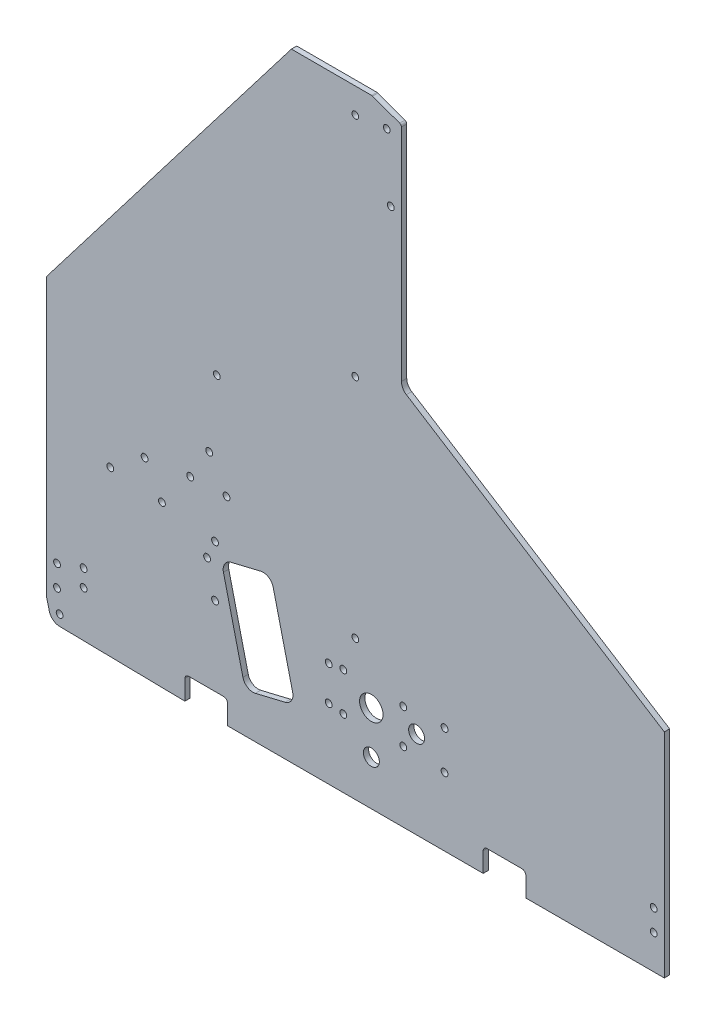
from build123d import *

# Parameters (mm, degrees)
SKETCH1_R           = 2.032
SKETCH1_R_2         = 2
BOSS_EXTRUDE1_DEPTH = 3.175
FILLET1_R           = 2.286
FILLET2_R           = 6.35
SKETCH2_R           = 2.032
CUT_EXTRUDE1_DEPTH  = 507.700158896
FILLET3_R           = 1.5875
CUT_EXTRUDE2_DEPTH  = 507.700158896
SKETCH4_R           = 2.032
SKETCH4_R_2         = 6.985
SKETCH4_R_3         = 4.7625
CUT_EXTRUDE3_DEPTH  = 507.700158896


with BuildPart() as part:
    # Sketch1 → Boss-Extrude1 (new body)
    with BuildSketch(Plane.XY):
        with BuildLine():
            Line((7.829508682, -19.049081656), (82.55, -20.32))
            Line((82.55, -20.32), (82.55, -6.35))
            Line((82.55, -6.35), (107.95, -6.35))
            Line((107.95, -6.35), (107.95, -20.32))
            Line((107.95, -20.32), (260.35, -20.32))
            Line((260.35, -20.32), (260.35, -6.35))
            Line((260.35, -6.35), (285.75, -6.35))
            Line((285.75, -6.35), (285.75, -20.32))
            Line((285.75, -20.32), (368.3, -20.32))
            Line((368.3, -20.32), (368.3, 106.68))
            Line((368.3, 106.68), (211.61375, 205.74))
            Line((211.61375, 205.74), (211.61375, 341.63))
            Line((211.61375, 341.63), (194.14998, 347.98))
            Line((194.14998, 347.98), (184.15, 347.98))
            Line((184.15, 347.98), (146.05, 347.98))
            Line((146.05, 347.98), (0, 157.48))
            Line((0, 157.48), (0, 0))
            Line((0, 0), (0, -6.35))
            ThreePointArc((0, -6.35), (0.047577015, -7.125863724), (0.189595124, -7.890101219))
            Line((0.189595124, -7.890101219), (1.777095124, -14.240101219))
            ThreePointArc((1.777095124, -14.240101219), (3.987212552, -17.671692778), (7.829508682, -19.049081656))
        make_face()
        with Locations((7.9375, -12.7)):
            Circle(SKETCH1_R, mode=Mode.SUBTRACT)
        with Locations((6.35, 0)):
            Circle(SKETCH1_R, mode=Mode.SUBTRACT)
        with Locations((6.35, 12.7)):
            Circle(SKETCH1_R, mode=Mode.SUBTRACT)
        with Locations((95.797306087, 60.410494967)):
            Circle(SKETCH1_R, mode=Mode.SUBTRACT)
        with Locations((184.15, 62.98)):
            Circle(SKETCH1_R_2, mode=Mode.SUBTRACT)
        with Locations((38.1, 78.105)):
            Circle(SKETCH1_R, mode=Mode.SUBTRACT)
        with Locations((68.887329744, 75.518700365)):
            Circle(SKETCH1_R, mode=Mode.SUBTRACT)
        with Locations((58.568579744, 93.391299635)):
            Circle(SKETCH1_R, mode=Mode.SUBTRACT)
        with Locations((85.725, 97.155)):
            Circle(SKETCH1_R, mode=Mode.SUBTRACT)
        with Locations((107.382158942, 97.743700365)):
            Circle(SKETCH1_R, mode=Mode.SUBTRACT)
        with Locations((97.063408942, 115.616299635)):
            Circle(SKETCH1_R, mode=Mode.SUBTRACT)
        with Locations((101.6, 157.48)):
            Circle(SKETCH1_R, mode=Mode.SUBTRACT)
        with Locations((361.95, 0)):
            Circle(SKETCH1_R, mode=Mode.SUBTRACT)
        with Locations((361.95, 12.7)):
            Circle(SKETCH1_R, mode=Mode.SUBTRACT)
        with Locations((184.15, 197.98)):
            Circle(SKETCH1_R_2, mode=Mode.SUBTRACT)
        with Locations((184.15, 332.98)):
            Circle(SKETCH1_R_2, mode=Mode.SUBTRACT)
        with Locations((205.26375, 296.418)):
            Circle(SKETCH1_R, mode=Mode.SUBTRACT)
        with Locations((202.881865, 335.28)):
            Circle(SKETCH1_R_2, mode=Mode.SUBTRACT)
    extrude(amount=BOSS_EXTRUDE1_DEPTH)

    # Fillet1
    fillet1_edges = [part.edges().sort_by_distance(p)[0] for p in [
        (285.75, -6.35, 1.5875),
        (107.95, -6.35, 1.5875),
        (260.35, -6.35, 1.5875),
        (82.55, -6.35, 1.5875),
    ]]
    fillet(fillet1_edges, radius=FILLET1_R)

    # Fillet2
    fillet2_edges = [part.edges().sort_by_distance(p)[0] for p in [
        (211.61375, 205.74, 1.5875),
    ]]
    fillet(fillet2_edges, radius=FILLET2_R)

    # Sketch2 → Cut-Extrude1 (cut, through all)
    with BuildSketch(Plane(origin=(0, 0, 0), x_dir=(-1, 0, 0), z_dir=(0, 0, -1))):
        with Locations((-100.552770272, 71.086035298)):
            Circle(SKETCH2_R)
        with Locations((-100.552770272, 40.606035298)):
            Circle(SKETCH2_R)
        with Locations((-22.225, 18.202541089)):
            Circle(SKETCH2_R)
        with Locations((-22.225, 8.042541089)):
            Circle(SKETCH2_R)
    extrude(amount=-CUT_EXTRUDE1_DEPTH, mode=Mode.SUBTRACT)

    # Fillet3
    fillet3_edges = [part.edges().sort_by_distance(p)[0] for p in [
        (211.61375, 341.63, 1.5875),
        (194.14998, 347.98, 1.5875),
    ]]
    fillet(fillet3_edges, radius=FILLET3_R)

    # Sketch3 → Cut-Extrude2 (cut, through all)
    with BuildSketch(Plane.XY.offset(3.175)):
        with BuildLine():
            Line((127.789350211, 69.359774106), (110.090750339, 65.117184968))
            ThreePointArc((110.090750339, 65.117184968), (106.287939856, 62.356288953), (105.55119507, 57.715047577))
            Line((105.55119507, 57.715047577), (117.160037875, 9.287010566))
            ThreePointArc((117.160037875, 9.287010566), (119.92093389, 5.484200083), (124.562175266, 4.747455297))
            Line((124.562175266, 4.747455297), (142.260775137, 8.990044434))
            ThreePointArc((142.260775137, 8.990044434), (146.063585621, 11.75094045), (146.800330407, 16.392181825))
            Line((146.800330407, 16.392181825), (135.191487602, 64.820218836))
            ThreePointArc((135.191487602, 64.820218836), (132.430591586, 68.62302932), (127.789350211, 69.359774106))
        make_face()
    extrude(amount=-CUT_EXTRUDE2_DEPTH, mode=Mode.SUBTRACT)

    # Sketch4 → Cut-Extrude3 (cut, through all)
    with BuildSketch(Plane.XY.offset(3.175)):
        with Locations((168.275, 42.06875)):
            Circle(SKETCH4_R)
        with Locations((212.725, 42.06875)):
            Circle(SKETCH4_R)
        with Locations((212.725, 21.43125)):
            Circle(SKETCH4_R)
        with Locations((168.275, 21.43125)):
            Circle(SKETCH4_R)
        with Locations((193.675, 31.75)):
            Circle(SKETCH4_R_2)
        with Locations((220.6625, 31.75)):
            Circle(SKETCH4_R_3)
        with Locations((177.00498, 43.2181)):
            Circle(SKETCH4_R)
        with Locations((177.00498, 20.2819)):
            Circle(SKETCH4_R)
        with Locations((237.32998, 43.2181)):
            Circle(SKETCH4_R)
        with Locations((237.32998, 20.2819)):
            Circle(SKETCH4_R)
        with Locations((193.675, 6.35)):
            Circle(SKETCH4_R_3)
    extrude(amount=-CUT_EXTRUDE3_DEPTH, mode=Mode.SUBTRACT)


solid = part.part
